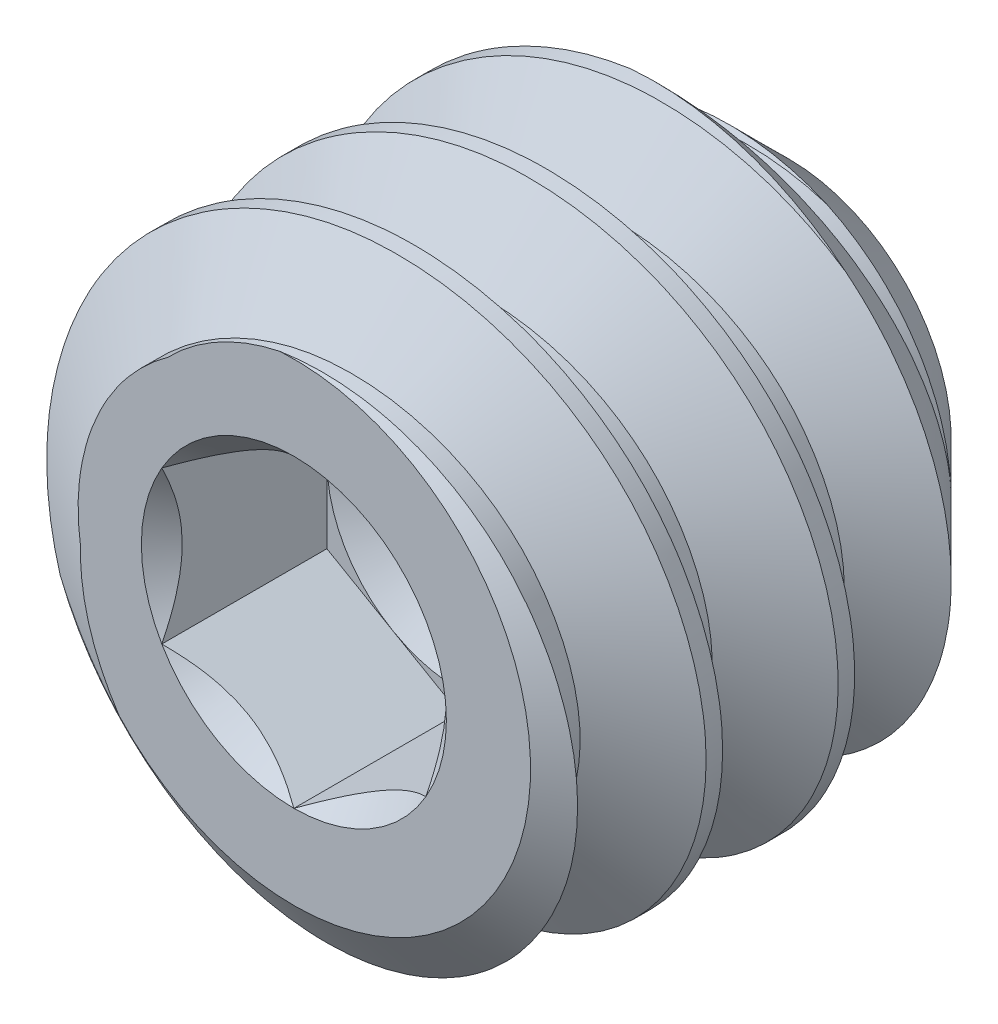
from build123d import *

# Parameters (mm, degrees)
CUT_SWEEP2_PITCH    = 0.635
CUT_EXTRUDE10_DEPTH = 0.79375


with BuildPart() as part:
    # Sketch22 → Revolve1 (revolve)
    with BuildSketch(Plane(origin=(0, 0, 0), x_dir=(0, 0, -1), z_dir=(1, 0, 0)), mode=Mode.PRIVATE) as revolve1_sk:
        Polygon((-0.956462021, 0), (-0.956462021, 1.13792), (-0.757266981, 1.4224), (0.781813262, 1.4224), (1.424787979, 0.779425283), (0.956462021, 0), align=None)
    revolve(revolve1_sk.sketch.rotate(Axis((0, 0, -0.956462021), (0, 0, -1)), 180), axis=Axis((0, 0, -0.956462021), (0, 0, -1)))

    # Cut-Sweep2: the profile of Sketch28 profile screwed along a right-hand helix of 5.15 turns, 6 arcs to a turn; built about Z, then put on its axis
    cut_sweep2_z = Axis((0, 0, 0), (0, 0, 1))
    cut_sweep2_corners = [(1.4227, 0, 0.000173205), (1.4227, 0, -0.555798205), (1.037451708, 0, -0.333375), (1.037451708, 0, -0.22225)]
    with BuildLine(mode=Mode.PRIVATE) as cut_sweep2_profile:
        Line(cut_sweep2_corners[0], cut_sweep2_corners[1])
        Line(cut_sweep2_corners[1], cut_sweep2_corners[2])
        Line(cut_sweep2_corners[2], cut_sweep2_corners[3])
        Line(cut_sweep2_corners[3], cut_sweep2_corners[0])
    cut_sweep2_cap = Face(cut_sweep2_profile.wire())
    cut_sweep2_turn_angles = [0, 30, 60, 90, 120, 150, 180, 210, 240, 270, 300, 330, 360]
    cut_sweep2_turn_weights = [1, 0.8660254037844387, 1, 0.8660254037844387, 1, 0.8660254037844387, 1, 0.8660254037844387, 1, 0.8660254037844387, 1, 0.8660254037844387, 1]
    cut_sweep2_turn_rails = [Edge.make_bspline([Vector(p[0], p[1], 0).rotate(cut_sweep2_z, cut_sweep2_turn_angles[k]) / cut_sweep2_turn_weights[k] + Vector(0, 0, p[2] + CUT_SWEEP2_PITCH * cut_sweep2_turn_angles[k] / 360) for k in range(13)], [0, 0, 0, 1, 1, 2, 2, 3, 3, 4, 4, 5, 5, 6, 6, 6], 2, cut_sweep2_turn_weights) for p in cut_sweep2_corners]
    cut_sweep2_turn_sides = [Face.make_surface_from_curves(cut_sweep2_turn_rails[p[0]], cut_sweep2_turn_rails[p[1]]) for p in [(0, 1), (1, 2), (2, 3), (3, 0)]]
    cut_sweep2_last_angles = [1800, 1827, 1854]
    cut_sweep2_last_weights = [1, 0.8910065241883237, 1]
    cut_sweep2_last_rails = [Edge.make_bspline([Vector(p[0], p[1], 0).rotate(cut_sweep2_z, cut_sweep2_last_angles[k]) / cut_sweep2_last_weights[k] + Vector(0, 0, p[2] + CUT_SWEEP2_PITCH * cut_sweep2_last_angles[k] / 360) for k in range(3)], [0, 0, 0, 1, 1, 1], 2, cut_sweep2_last_weights) for p in cut_sweep2_corners]
    cut_sweep2_last_sides = [Face.make_surface_from_curves(cut_sweep2_last_rails[p[0]], cut_sweep2_last_rails[p[1]]) for p in [(0, 1), (1, 2), (2, 3), (3, 0)]]
    cut_sweep2 = Plane(origin=(0, 0, -1.424787979), x_dir=(0, 1, 0), z_dir=(0, 0, 1)) * Solid(Shell([*[p.moved(Location((0, 0, CUT_SWEEP2_PITCH * i))) for i in range(5) for p in cut_sweep2_turn_sides], *cut_sweep2_last_sides, cut_sweep2_cap, cut_sweep2_cap.rotate(cut_sweep2_z, 1854).moved(Location((0, 0, CUT_SWEEP2_PITCH * 1854 / 360)))]))
    add(cut_sweep2, mode=Mode.SUBTRACT)

    # Sketch23 → Cut-Extrude10 (cut)
    with BuildSketch(Plane.XY.offset(0.956462021)):
        Polygon((0, 0.733234842), (-0.635, 0.366617421), (-0.635, -0.366617421), (0, -0.733234842), (0.635, -0.366617421), (0.635, 0.366617421), align=None)
    extrude(amount=-CUT_EXTRUDE10_DEPTH, mode=Mode.SUBTRACT)

    # Cut-Extrude11 cone 1 section (through the dimple's axis) → Cut-Extrude11 (revolve, cut)
    with BuildSketch(Plane(origin=(0, 0, 0.956462021), x_dir=(0, -1, 0), z_dir=(1, 0, 0))):
        Polygon((0, 0), (0.733234842, 0), (0, 0.733234842), align=None)
    revolve(axis=Axis((0, 0, 0.956462021), (0, 0, -1)), mode=Mode.SUBTRACT)

    # Cut-Extrude12 cone 1 section (through the dimple's axis) → Cut-Extrude12 (revolve, cut)
    with BuildSketch(Plane(origin=(0, 0, 0.162712021), x_dir=(0, -1, 0), z_dir=(1, 0, 0))):
        Polygon((0, 0), (0.635, 0), (0, 0.366617421), align=None)
    revolve(axis=Axis((0, 0, 0.162712021), (0, 0, -1)), mode=Mode.SUBTRACT)


solid = part.part
